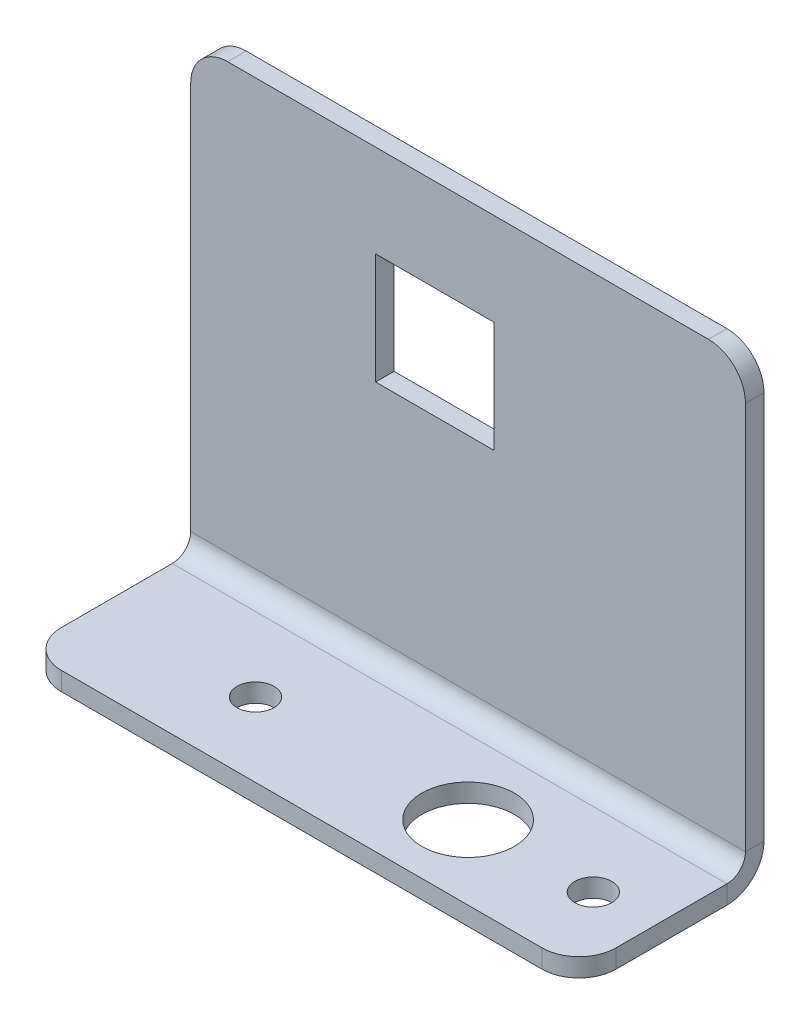
from build123d import *

# Parameters (mm, degrees)
BOSS_EXTRUDE1_DEPTH    = 38.1
SKETCH2_W              = 8.128
SKETCH2_H              = 7.62
CUT_EXTRUDE1_DEPTH     = 52.195336702
CONVERT_SOLID1_DEPTH   = 38.1
CONVERT_SOLID1_2_DEPTH = 38.1
FILLET1_R              = 2.54
SKETCH7_R              = 3.175
CUT_EXTRUDE2_DEPTH     = 52.195336702
SKETCH8_R              = 1.27
CUT_EXTRUDE3_DEPTH     = 52.195336702


# Read off the part's stored shape, not the designer's step: Convert-Solid1
with BuildPart() as part:
    # Sketch1 → Boss-Extrude1 (new body)
    with BuildSketch(Plane(origin=(0, 0, 0), x_dir=(0, 0, -1), z_dir=(1, 0, 0))):
        Polygon((0, 0), (12.7, 0), (12.7, 31.75), (11.43, 31.75), (11.43, 1.27), (0, 1.27), align=None)
    extrude(amount=BOSS_EXTRUDE1_DEPTH)

    # Sketch2 → Cut-Extrude1 (cut, through all)
    with BuildSketch(Plane(origin=(0, 0, -12.7), x_dir=(-1, 0, 0), z_dir=(0, 0, -1))):
        with Locations((-16.764, 21.59)):
            Rectangle(SKETCH2_W, SKETCH2_H)
    extrude(amount=-CUT_EXTRUDE1_DEPTH, mode=Mode.SUBTRACT)

    # Convert-Solid1 outline → Convert-Solid1 (cut)
    with BuildSketch(Plane.YZ):
        with BuildLine():
            ThreePointArc((2.54, -12.7), (0.743948776, -11.956051224), (0, -10.16))
            Line((0, -10.16), (0, -12.7))
            Line((0, -12.7), (2.54, -12.7))
        make_face()
    extrude(amount=CONVERT_SOLID1_DEPTH, mode=Mode.SUBTRACT)

    # Convert-Solid1 2 outline → Convert-Solid1 2 (add)
    with BuildSketch(Plane.YZ):
        with BuildLine():
            ThreePointArc((2.54, -11.43), (1.641974388, -11.058025612), (1.27, -10.16))
            Line((1.27, -10.16), (1.27, -11.43))
            Line((1.27, -11.43), (2.54, -11.43))
        make_face()
    extrude(amount=CONVERT_SOLID1_2_DEPTH)

    # Fillet1
    fillet1_edges = [part.edges().sort_by_distance(p)[0] for p in [
        (0, 31.75, -12.065),
        (38.1, 31.75, -12.065),
        (38.1, 0.635, 0),
        (0, 0.635, 0),
    ]]
    fillet(fillet1_edges, radius=FILLET1_R)

    # Sketch7 → Cut-Extrude2 (cut, through all)
    with BuildSketch(Plane.XZ):
        with Locations(Location((25.4, -5.08, 0), (0, 0, 270))):
            Circle(SKETCH7_R)
    extrude(amount=-CUT_EXTRUDE2_DEPTH, mode=Mode.SUBTRACT)

    # Sketch8 → Cut-Extrude3 (cut, through all)
    with BuildSketch(Plane.XZ):
        with Locations(Location((10.8, -5.08, 0), (0, 0, 270))):
            Circle(SKETCH8_R)
        with Locations(Location((34, -5.08, 0), (0, 0, 270))):
            Circle(SKETCH8_R)
    extrude(amount=-CUT_EXTRUDE3_DEPTH, mode=Mode.SUBTRACT)


solid = part.part
